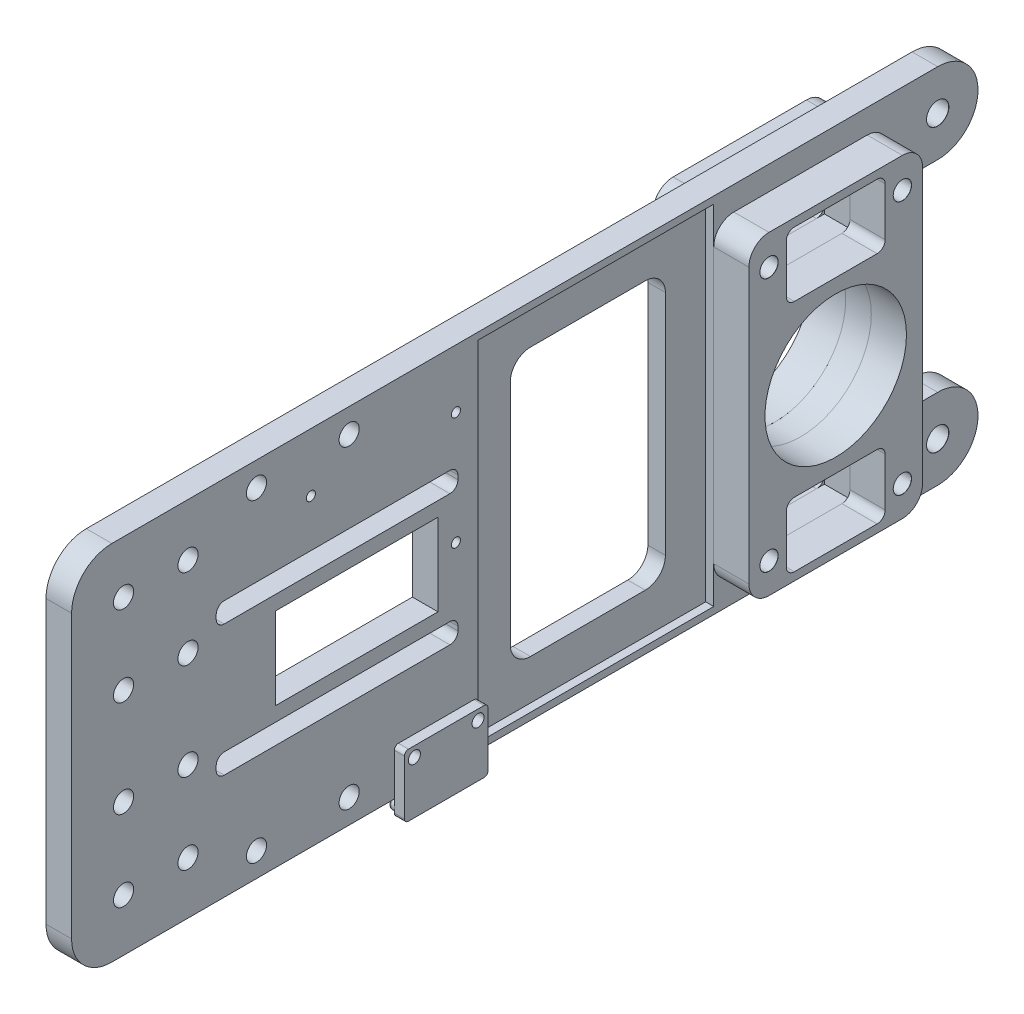
from build123d import *

# Parameters (mm, degrees)
SKETCH1_W                            = 90
SKETCH1_H                            = 225
SKETCH1_R                            = 17.5641
BOSS_EXTRUDE1_DEPTH                  = 3.175
SKETCH2_W                            = 78.1
SKETCH2_H                            = 43.1
BOSS_EXTRUDE2_DEPTH                  = 8.73125
M4_CLEARANCE_HOLE2_AT_2_COUNT        = 2
M4_CLEARANCE_HOLE2_AT_2_PITCH        = 33.1
M4_CLEARANCE_HOLE2_AT_3_COUNT        = 2
M4_CLEARANCE_HOLE2_AT_3_PITCH        = 71.254613886
M4_CLEARANCE_HOLE2_AT_4_COUNT        = 2
M4_CLEARANCE_HOLE2_AT_4_PITCH        = 63.1
SKETCH24_W                           = 78.1
SKETCH24_H                           = 43.1
BOSS_EXTRUDE3_DEPTH                  = 8.73125
TAP_DRILL_FOR_M4X0_7_TAP1_AT_2_COUNT = 2
TAP_DRILL_FOR_M4X0_7_TAP1_AT_2_PITCH = 33.1
TAP_DRILL_FOR_M4X0_7_TAP1_AT_3_COUNT = 2
TAP_DRILL_FOR_M4X0_7_TAP1_AT_3_PITCH = 71.254613886
TAP_DRILL_FOR_M4X0_7_TAP1_AT_4_COUNT = 2
TAP_DRILL_FOR_M4X0_7_TAP1_AT_4_PITCH = 63.1
TAP_DRILL_FOR_M3X0_5_TAP1_AT_2_COUNT = 2
TAP_DRILL_FOR_M3X0_5_TAP1_AT_2_PITCH = 15.8
SKETCH3_R                            = 17.5641
CUT_EXTRUDE3_DEPTH                   = 188.975896477
M5_CLEARANCE_HOLE1_AT_2_COUNT        = 2
M5_CLEARANCE_HOLE1_AT_2_PITCH        = 70
SKETCH14_W                           = 86.5
SKETCH14_H                           = 58.5
CUT_EXTRUDE4_DEPTH                   = 2
FILLET4_R                            = 10
FILLET5_R                            = 5
FILLET6_R                            = 5
SKETCH28_W                           = 15.5
SKETCH28_H                           = 20.75
SKETCH28_R                           = 1.5
BOSS_EXTRUDE4_DEPTH                  = 2.5
FILLET7_R                            = 1
SKETCH29_R                           = 1.5
BOSS_EXTRUDE5_DEPTH                  = 1.5
FILLET8_R                            = 0.5
SKETCH34_W                           = 1.1303
SKETCH34_H                           = 15.08125
TAP_DRILL_FOR_4_40_TAP1_AT_2_COUNT   = 2
TAP_DRILL_FOR_4_40_TAP1_AT_2_PITCH   = 36
TAP_DRILL_FOR_4_40_TAP1_AT_3_COUNT   = 2
TAP_DRILL_FOR_4_40_TAP1_AT_3_PITCH   = 45.607017004
TAP_DRILL_FOR_4_40_TAP1_AT_4_COUNT   = 2
TAP_DRILL_FOR_4_40_TAP1_AT_4_PITCH   = 28
SKETCH36_W                           = 16
SKETCH36_H                           = 24.55
CUT_EXTRUDE6_DEPTH                   = 189.979862105
FILLET9_R                            = 2
FILLET10_R                           = 2
CUT_EXTRUDE7_DEPTH                   = 189.079231247
CUT_EXTRUDE7_DEPTH_BACK              = 189.079231247
CUT_EXTRUDE8_DEPTH                   = 189.079231247
SKETCH39_R                           = 2.5
CUT_EXTRUDE9_DEPTH                   = 189.079231247
SKETCH40_W                           = 40.35
SKETCH40_H                           = 20.35
CUT_EXTRUDE10_DEPTH                  = 189.079231247


with BuildPart() as part:
    # Sketch1 → Boss-Extrude1 (new, symmetric)
    with BuildSketch(Plane.YZ):
        with Locations((0, 68.45)):
            Rectangle(SKETCH1_W, SKETCH1_H)
        Circle(SKETCH1_R, mode=Mode.SUBTRACT)
    extrude(amount=BOSS_EXTRUDE1_DEPTH, both=True)


with BuildPart() as body_2:
    # Sketch2 → Boss-Extrude2 (new body)
    with BuildSketch(Plane.YZ.offset(3.175)):
        Rectangle(SKETCH2_W, SKETCH2_H)
    extrude(amount=BOSS_EXTRUDE2_DEPTH)


with BuildPart() as m4_clearance_hole2_tool:
    # Sketch23 → M4 Clearance Hole2 (revolve)
    with BuildSketch(Plane(origin=(11.90625, -31.55, 16.55), x_dir=(0, 0, -1), z_dir=(0, 1, 0))):
        Polygon((0, 0), (0, 15.08125), (2.25, 15.08125), (2.25, 0.025), (2.275, 0), align=None)
    m4_clearance_hole2 = revolve(axis=Axis((18.25625, -31.55, 16.55), (-1, 0, 0)))


with BuildPart() as part_1:
    add(part.part)

    # M4 Clearance Hole2: cut by m4_clearance_hole2_tool
    add(m4_clearance_hole2_tool.part, mode=Mode.SUBTRACT)


with BuildPart() as body_2_1:
    add(body_2.part)

    # M4 Clearance Hole2: cut by m4_clearance_hole2_tool
    add(m4_clearance_hole2_tool.part, mode=Mode.SUBTRACT)


with BuildPart() as m4_clearance_hole2_at_2_tool:
    # M4 Clearance Hole2 at 2: M4 Clearance Hole2 ×2
    with Locations(*[(0, 0, -i * M4_CLEARANCE_HOLE2_AT_2_PITCH) for i in range(1, M4_CLEARANCE_HOLE2_AT_2_COUNT)]):
        add(m4_clearance_hole2)


with BuildPart() as part_2:
    add(part_1.part)

    # M4 Clearance Hole2 at 2: cut by m4_clearance_hole2_at_2_tool
    add(m4_clearance_hole2_at_2_tool.part, mode=Mode.SUBTRACT)


with BuildPart() as body_2_2:
    add(body_2_1.part)

    # M4 Clearance Hole2 at 2: cut by m4_clearance_hole2_at_2_tool
    add(m4_clearance_hole2_at_2_tool.part, mode=Mode.SUBTRACT)


with BuildPart() as m4_clearance_hole2_at_3_tool:
    # M4 Clearance Hole2 at 3: M4 Clearance Hole2 ×2
    with Locations(*[Vector(0, 0.8855566897214588, -0.4645313221835228) * (i * M4_CLEARANCE_HOLE2_AT_3_PITCH) for i in range(1, M4_CLEARANCE_HOLE2_AT_3_COUNT)]):
        add(m4_clearance_hole2)


with BuildPart() as part_3:
    add(part_2.part)

    # M4 Clearance Hole2 at 3: cut by m4_clearance_hole2_at_3_tool
    add(m4_clearance_hole2_at_3_tool.part, mode=Mode.SUBTRACT)


with BuildPart() as body_2_3:
    add(body_2_2.part)

    # M4 Clearance Hole2 at 3: cut by m4_clearance_hole2_at_3_tool
    add(m4_clearance_hole2_at_3_tool.part, mode=Mode.SUBTRACT)


with BuildPart() as m4_clearance_hole2_at_4_tool:
    # M4 Clearance Hole2 at 4: M4 Clearance Hole2 ×2
    with Locations(*[(0, i * M4_CLEARANCE_HOLE2_AT_4_PITCH, 0) for i in range(1, M4_CLEARANCE_HOLE2_AT_4_COUNT)]):
        add(m4_clearance_hole2)


with BuildPart() as part_4:
    add(part_3.part)

    # M4 Clearance Hole2 at 4: cut by m4_clearance_hole2_at_4_tool
    add(m4_clearance_hole2_at_4_tool.part, mode=Mode.SUBTRACT)

    # Sketch10 → Tap Drill for M3x0.5 Tap1 (revolve, cut)
    with BuildSketch(Plane(origin=(3.175, -36, 98.35), x_dir=(0, 0, -1), z_dir=(0, 1, 0))):
        Polygon((0, 0), (0, 15.08125), (1.25, 15.08125), (1.25, 0.025), (1.275, 0), align=None)
    tap_drill_for_m3x0_5_tap1 = revolve(axis=Axis((9.525, -36, 98.35), (-1, 0, 0)), mode=Mode.SUBTRACT)

    # Tap Drill for M3x0.5 Tap1 at 2: Tap Drill for M3x0.5 Tap1 ×2
    with Locations(*[(0, 0, -i * TAP_DRILL_FOR_M3X0_5_TAP1_AT_2_PITCH) for i in range(1, TAP_DRILL_FOR_M3X0_5_TAP1_AT_2_COUNT)]):
        add(tap_drill_for_m3x0_5_tap1, mode=Mode.SUBTRACT)

    # Sketch12 → M5 Clearance Hole1 (revolve, cut)
    with BuildSketch(Plane(origin=(3.175, -35, -34.05), x_dir=(0, 0, -1), z_dir=(0, 1, 0))):
        Polygon((0, 0), (0, 15.08125), (2.75, 15.08125), (2.75, 0.025), (2.775, 0), align=None)
    m5_clearance_hole1 = revolve(axis=Axis((9.525, -35, -34.05), (-1, 0, 0)), mode=Mode.SUBTRACT)

    # M5 Clearance Hole1 at 2: M5 Clearance Hole1 ×2
    with Locations(*[(0, i * M5_CLEARANCE_HOLE1_AT_2_PITCH, 0) for i in range(1, M5_CLEARANCE_HOLE1_AT_2_COUNT)]):
        add(m5_clearance_hole1, mode=Mode.SUBTRACT)

    # Sketch14 → Cut-Extrude4 (cut)
    with BuildSketch(Plane.YZ.offset(3.175)):
        with Locations((0, 50.8)):
            Rectangle(SKETCH14_W, SKETCH14_H)
    extrude(amount=-CUT_EXTRUDE4_DEPTH, mode=Mode.SUBTRACT)

    # Fillet4
    fillet4_edges = [part_4.edges().sort_by_distance(p)[0] for p in [
        (0, 45, -44.05),
        (0, -45, -44.05),
        (0, 45, 180.95),
        (0, -45, 180.95),
    ]]
    fillet(fillet4_edges, radius=FILLET4_R)

    # Sketch34 → Tap Drill for #4-40 Tap1 (revolve, cut)
    with BuildSketch(Plane(origin=(3.175, 2.5, 121.55), x_dir=(0, 0, -1), z_dir=(0, 1, 0))):
        with Locations((0.56515, 7.540625)):
            Rectangle(SKETCH34_W, SKETCH34_H)
    tap_drill_for_4_40_tap1 = revolve(axis=Axis((9.525, 2.5, 121.55), (-1, 0, 0)), mode=Mode.SUBTRACT)

    # Tap Drill for #4-40 Tap1 at 2: Tap Drill for #4-40 Tap1 ×2
    with Locations(*[(0, 0, -i * TAP_DRILL_FOR_4_40_TAP1_AT_2_PITCH) for i in range(1, TAP_DRILL_FOR_4_40_TAP1_AT_2_COUNT)]):
        add(tap_drill_for_4_40_tap1, mode=Mode.SUBTRACT)

    # Tap Drill for #4-40 Tap1 at 3: Tap Drill for #4-40 Tap1 ×2
    with Locations(*[Vector(0, 0.6139406135149202, -0.7893522173763264) * (i * TAP_DRILL_FOR_4_40_TAP1_AT_3_PITCH) for i in range(1, TAP_DRILL_FOR_4_40_TAP1_AT_3_COUNT)]):
        add(tap_drill_for_4_40_tap1, mode=Mode.SUBTRACT)

    # Tap Drill for #4-40 Tap1 at 4: Tap Drill for #4-40 Tap1 ×2
    with Locations(*[(0, i * TAP_DRILL_FOR_4_40_TAP1_AT_4_PITCH, 0) for i in range(1, TAP_DRILL_FOR_4_40_TAP1_AT_4_COUNT)]):
        add(tap_drill_for_4_40_tap1, mode=Mode.SUBTRACT)


with BuildPart() as body_2_4:
    add(body_2_3.part)

    # M4 Clearance Hole2 at 4: cut by m4_clearance_hole2_at_4_tool
    add(m4_clearance_hole2_at_4_tool.part, mode=Mode.SUBTRACT)


with BuildPart() as body_3:
    # Sketch24 → Boss-Extrude3 (new body)
    with BuildSketch(Plane(origin=(-3.175, 0, 0), x_dir=(0, -1, 0), z_dir=(-1, 0, 0))):
        Rectangle(SKETCH24_W, SKETCH24_H)
    extrude(amount=BOSS_EXTRUDE3_DEPTH)

    # Sketch27 → Tap Drill for M4x0.7 Tap1 (revolve, cut)
    with BuildSketch(Plane(origin=(-11.90625, 31.55, 16.55), x_dir=(0, 0, 1), z_dir=(0, 1, 0))):
        Polygon((0, 0), (0, 9.722670021), (1.65, 8.73125), (1.65, 0.025), (1.675, 0), align=None)
    tap_drill_for_m4x0_7_tap1 = revolve(axis=Axis((-18.25625, 31.55, 16.55), (1, 0, 0)), mode=Mode.SUBTRACT)

    # Tap Drill for M4x0.7 Tap1 at 2: Tap Drill for M4x0.7 Tap1 ×2
    with Locations(*[(0, 0, -i * TAP_DRILL_FOR_M4X0_7_TAP1_AT_2_PITCH) for i in range(1, TAP_DRILL_FOR_M4X0_7_TAP1_AT_2_COUNT)]):
        add(tap_drill_for_m4x0_7_tap1, mode=Mode.SUBTRACT)

    # Tap Drill for M4x0.7 Tap1 at 3: Tap Drill for M4x0.7 Tap1 ×2
    with Locations(*[Vector(0, -0.8855566897214588, -0.4645313221835228) * (i * TAP_DRILL_FOR_M4X0_7_TAP1_AT_3_PITCH) for i in range(1, TAP_DRILL_FOR_M4X0_7_TAP1_AT_3_COUNT)]):
        add(tap_drill_for_m4x0_7_tap1, mode=Mode.SUBTRACT)

    # Tap Drill for M4x0.7 Tap1 at 4: Tap Drill for M4x0.7 Tap1 ×2
    with Locations(*[(0, -i * TAP_DRILL_FOR_M4X0_7_TAP1_AT_4_PITCH, 0) for i in range(1, TAP_DRILL_FOR_M4X0_7_TAP1_AT_4_COUNT)]):
        add(tap_drill_for_m4x0_7_tap1, mode=Mode.SUBTRACT)


with BuildPart() as cut_extrude3_tool:
    # Sketch3 → Cut-Extrude3 (new, through all)
    with BuildSketch(Plane.YZ.offset(11.90625)):
        Circle(SKETCH3_R)
    extrude(amount=-CUT_EXTRUDE3_DEPTH)


with BuildPart() as body_2_5:
    add(body_2_4.part)

    # Cut-Extrude3: cut by cut_extrude3_tool
    add(cut_extrude3_tool.part, mode=Mode.SUBTRACT)

    # Fillet6
    fillet6_edges = [body_2_5.edges().sort_by_distance(p)[0] for p in [
        (7.540625, -39.05, 21.55),
        (7.540625, 39.05, -21.55),
        (7.540625, -39.05, -21.55),
        (7.540625, 39.05, 21.55),
    ]]
    fillet(fillet6_edges, radius=FILLET6_R)


with BuildPart() as body_3_1:
    add(body_3.part)

    # Cut-Extrude3: cut by cut_extrude3_tool
    add(cut_extrude3_tool.part, mode=Mode.SUBTRACT)

    # Fillet5
    fillet5_edges = [body_3_1.edges().sort_by_distance(p)[0] for p in [
        (-7.540625, -39.05, 21.55),
        (-7.540625, -39.05, -21.55),
        (-7.540625, 39.05, -21.55),
        (-7.540625, 39.05, 21.55),
    ]]
    fillet(fillet5_edges, radius=FILLET5_R)


with BuildPart() as body_4:
    # Sketch28 → Boss-Extrude4 (new body)
    with BuildSketch(Plane.YZ.offset(3.175)):
        with Locations((-41.275, 90.45)):
            Rectangle(SKETCH28_W, SKETCH28_H)
        with Locations((-36, 82.55)):
            Circle(SKETCH28_R, mode=Mode.SUBTRACT)
        with Locations((-36, 98.35)):
            Circle(SKETCH28_R, mode=Mode.SUBTRACT)
    extrude(amount=BOSS_EXTRUDE4_DEPTH)

    # Fillet7
    fillet7_edges = [body_4.edges().sort_by_distance(p)[0] for p in [
        (4.425, -33.525, 100.825),
        (4.425, -33.525, 80.075),
        (4.425, -49.025, 80.075),
        (4.425, -49.025, 100.825),
    ]]
    fillet(fillet7_edges, radius=FILLET7_R)

    # Sketch29 → Boss-Extrude5 (add)
    with BuildSketch(Plane(origin=(3.175, 0, 0), x_dir=(0, -1, 0), z_dir=(-1, 0, 0))):
        with Locations((47.025, 99.2)):
            Circle(SKETCH29_R)
        with Locations((47.025, 95.7)):
            Circle(SKETCH29_R)
        with Locations((47.025, 92.2)):
            Circle(SKETCH29_R)
        with Locations((47.025, 88.7)):
            Circle(SKETCH29_R)
        with Locations((47.025, 85.2)):
            Circle(SKETCH29_R)
        with Locations((47.025, 81.7)):
            Circle(SKETCH29_R)
    extrude(amount=BOSS_EXTRUDE5_DEPTH)

    # Fillet8
    fillet8_edges = [body_4.edges().sort_by_distance(p)[0] for p in [
        (1.675, -45.525, 81.7),
        (1.675, -45.525, 85.2),
        (1.675, -45.525, 88.7),
        (1.675, -45.525, 92.2),
        (1.675, -45.525, 95.7),
        (1.675, -45.525, 99.2),
    ]]
    fillet(fillet8_edges, radius=FILLET8_R)


with BuildPart() as cut_extrude6_tool:
    # Sketch36 → Cut-Extrude6 (new, through all)
    with BuildSketch(Plane.YZ.offset(11.90625)):
        with Locations((-29.05, 0)):
            Rectangle(SKETCH36_W, SKETCH36_H)
        with Locations((29.05, 0)):
            Rectangle(SKETCH36_W, SKETCH36_H)
    extrude(amount=-CUT_EXTRUDE6_DEPTH)


with BuildPart() as part_5:
    add(part_4.part)

    # Cut-Extrude6: cut by cut_extrude6_tool
    add(cut_extrude6_tool.part, mode=Mode.SUBTRACT)

    # Sketch37 → Cut-Extrude7 (cut, two sides: drawn at the far end of the back side and taken through both)
    with BuildSketch(Plane.YZ.offset(3.175).offset(-CUT_EXTRUDE7_DEPTH_BACK)):
        with BuildLine():
            Line((-16.75, 145.05), (-15.75, 145.05))
            ThreePointArc((-15.75, 145.05), (-14.335786438, 144.464213562), (-13.75, 143.05))
            Line((-13.75, 143.05), (-13.75, 87.05))
            ThreePointArc((-13.75, 87.05), (-14.335786438, 85.635786438), (-15.75, 85.05))
            Line((-15.75, 85.05), (-16.75, 85.05))
            ThreePointArc((-16.75, 85.05), (-18.164213562, 85.635786438), (-18.75, 87.05))
            Line((-18.75, 87.05), (-18.75, 143.05))
            ThreePointArc((-18.75, 143.05), (-18.164213562, 144.464213562), (-16.75, 145.05))
        make_face()
        with BuildLine():
            Line((13.75, 143.05), (13.75, 87.05))
            ThreePointArc((13.75, 87.05), (14.335786438, 85.635786438), (15.75, 85.05))
            Line((15.75, 85.05), (16.75, 85.05))
            ThreePointArc((16.75, 85.05), (18.164213562, 85.635786438), (18.75, 87.05))
            Line((18.75, 87.05), (18.75, 143.05))
            ThreePointArc((18.75, 143.05), (18.164213562, 144.464213562), (16.75, 145.05))
            Line((16.75, 145.05), (15.75, 145.05))
            ThreePointArc((15.75, 145.05), (14.335786438, 144.464213562), (13.75, 143.05))
        make_face()
    extrude(amount=CUT_EXTRUDE7_DEPTH + CUT_EXTRUDE7_DEPTH_BACK, mode=Mode.SUBTRACT)

    # Sketch38 → Cut-Extrude8 (cut, through all)
    with BuildSketch(Plane.YZ.offset(3.175)):
        with BuildLine():
            ThreePointArc((-33.25, 36.55), (-31.785533906, 33.014466094), (-28.25, 31.55))
            Line((-28.25, 31.55), (28.25, 31.55))
            ThreePointArc((28.25, 31.55), (31.785533906, 33.014466094), (33.25, 36.55))
            Line((33.25, 36.55), (33.25, 65.05))
            ThreePointArc((33.25, 65.05), (31.785533906, 68.585533906), (28.25, 70.05))
            Line((28.25, 70.05), (-28.25, 70.05))
            ThreePointArc((-28.25, 70.05), (-31.785533906, 68.585533906), (-33.25, 65.05))
            Line((-33.25, 65.05), (-33.25, 36.55))
        make_face()
        with BuildLine():
            ThreePointArc((-20, -24.05), (-23.535533906, -25.514466094), (-25, -29.05))
            Line((-25, -29.05), (-25, -34.05))
            ThreePointArc((-25, -34.05), (-27.928932188, -41.121067812), (-35, -44.05))
            Line((-35, -44.05), (35, -44.05))
            ThreePointArc((35, -44.05), (27.928932188, -41.121067812), (25, -34.05))
            Line((25, -34.05), (25, -29.05))
            ThreePointArc((25, -29.05), (23.535533906, -25.514466094), (20, -24.05))
            Line((20, -24.05), (-20, -24.05))
        make_face()
    extrude(amount=-CUT_EXTRUDE8_DEPTH, mode=Mode.SUBTRACT)

    # Sketch39 → Cut-Extrude9 (cut, through all)
    with BuildSketch(Plane.YZ.offset(3.175)):
        with Locations((39, 112.05)):
            Circle(SKETCH39_R)
        with Locations((32, 168.05)):
            Circle(SKETCH39_R)
        with Locations((32, 152.05)):
            Circle(SKETCH39_R)
        with Locations((12, 168.05)):
            Circle(SKETCH39_R)
        with Locations((12, 152.05)):
            Circle(SKETCH39_R)
        with Locations((39, 135.05)):
            Circle(SKETCH39_R)
        with Locations((-39, 135.05)):
            Circle(SKETCH39_R)
        with Locations((-12, 152.05)):
            Circle(SKETCH39_R)
        with Locations((-12, 168.05)):
            Circle(SKETCH39_R)
        with Locations((-32, 152.05)):
            Circle(SKETCH39_R)
        with Locations((-32, 168.05)):
            Circle(SKETCH39_R)
        with Locations((-39, 112.05)):
            Circle(SKETCH39_R)
    extrude(amount=-CUT_EXTRUDE9_DEPTH, mode=Mode.SUBTRACT)

    # Sketch40 → Cut-Extrude10 (cut, through all)
    with BuildSketch(Plane(origin=(3.175, 0, 0), x_dir=(0, 0, -1), z_dir=(1, 0, 0))):
        with Locations((-110.175, 0)):
            Rectangle(SKETCH40_W, SKETCH40_H)
    extrude(amount=-CUT_EXTRUDE10_DEPTH, mode=Mode.SUBTRACT)


with BuildPart() as body_2_6:
    add(body_2_5.part)

    # Cut-Extrude6: cut by cut_extrude6_tool
    add(cut_extrude6_tool.part, mode=Mode.SUBTRACT)

    # Fillet9
    fillet9_edges = [body_2_6.edges().sort_by_distance(p)[0] for p in [
        (7.540625, -37.05, 12.275),
        (7.540625, 21.05, -12.275),
        (7.540625, 37.05, -12.275),
        (7.540625, 37.05, 12.275),
        (7.540625, 21.05, 12.275),
        (7.540625, -21.05, -12.275),
        (7.540625, -37.05, -12.275),
        (7.540625, -21.05, 12.275),
    ]]
    fillet(fillet9_edges, radius=FILLET9_R)


with BuildPart() as body_3_2:
    add(body_3_1.part)

    # Cut-Extrude6: cut by cut_extrude6_tool
    add(cut_extrude6_tool.part, mode=Mode.SUBTRACT)

    # Fillet10
    fillet10_edges = [body_3_2.edges().sort_by_distance(p)[0] for p in [
        (-7.540625, -21.05, 12.275),
        (-7.540625, -21.05, -12.275),
        (-7.540625, -37.05, -12.275),
        (-7.540625, -37.05, 12.275),
        (-7.540625, 37.05, -12.275),
        (-7.540625, 21.05, -12.275),
        (-7.540625, 21.05, 12.275),
        (-7.540625, 37.05, 12.275),
    ]]
    fillet(fillet10_edges, radius=FILLET10_R)


solid = Compound([body_4.part, part_5.part, body_2_6.part, body_3_2.part])
